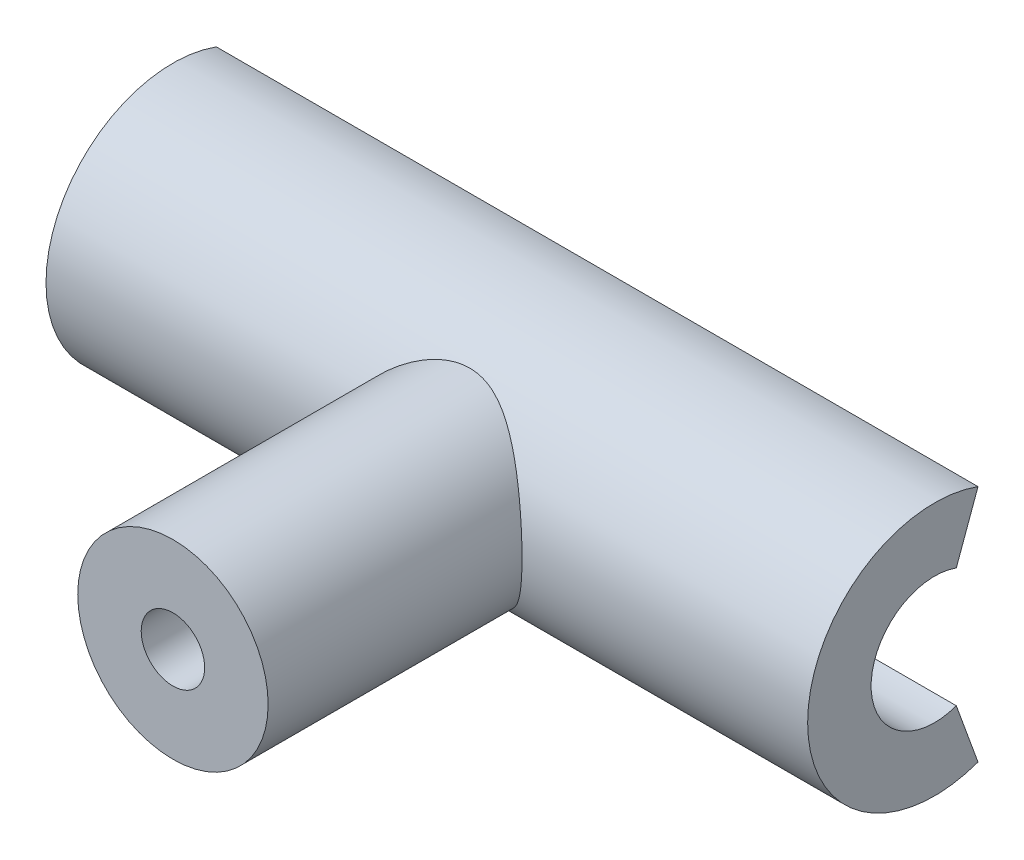
from build123d import *

# Parameters (mm, degrees)
SKETCH1_R           = 2.38125
SKETCH1_R_2         = 0.79375
BOSS_EXTRUDE1_DEPTH = 9.525
BOSS_EXTRUDE2_DEPTH = 19.05
SKETCH4_R           = 1.5875
CUT_EXTRUDE1_DEPTH  = 22.533897844


with BuildPart() as part:
    # Sketch1 → Boss-Extrude1 (new body)
    with BuildSketch(Plane.XY):
        Circle(SKETCH1_R)
        Circle(SKETCH1_R_2, mode=Mode.SUBTRACT)
    extrude(amount=BOSS_EXTRUDE1_DEPTH)

    # Sketch3 → Boss-Extrude2 (add)
    with BuildSketch(Plane.ZY.offset(9.525)):
        with BuildLine():
            Line((-1.085913955, -2.983524071), (-0.542956978, -1.491762035))
            ThreePointArc((-0.542956978, -1.491762035), (1.5875, 0), (-0.542956978, 1.491762035))
            Line((-0.542956978, 1.491762035), (-1.085913955, 2.983524071))
            ThreePointArc((-1.085913955, 2.983524071), (3.175, 0), (-1.085913955, -2.983524071))
        make_face()
    extrude(amount=-BOSS_EXTRUDE2_DEPTH)

    # Sketch4 → Cut-Extrude1 (cut, through all)
    with BuildSketch(Plane.ZY.offset(9.525)):
        Circle(SKETCH4_R)
    extrude(amount=-CUT_EXTRUDE1_DEPTH, mode=Mode.SUBTRACT)


solid = part.part
